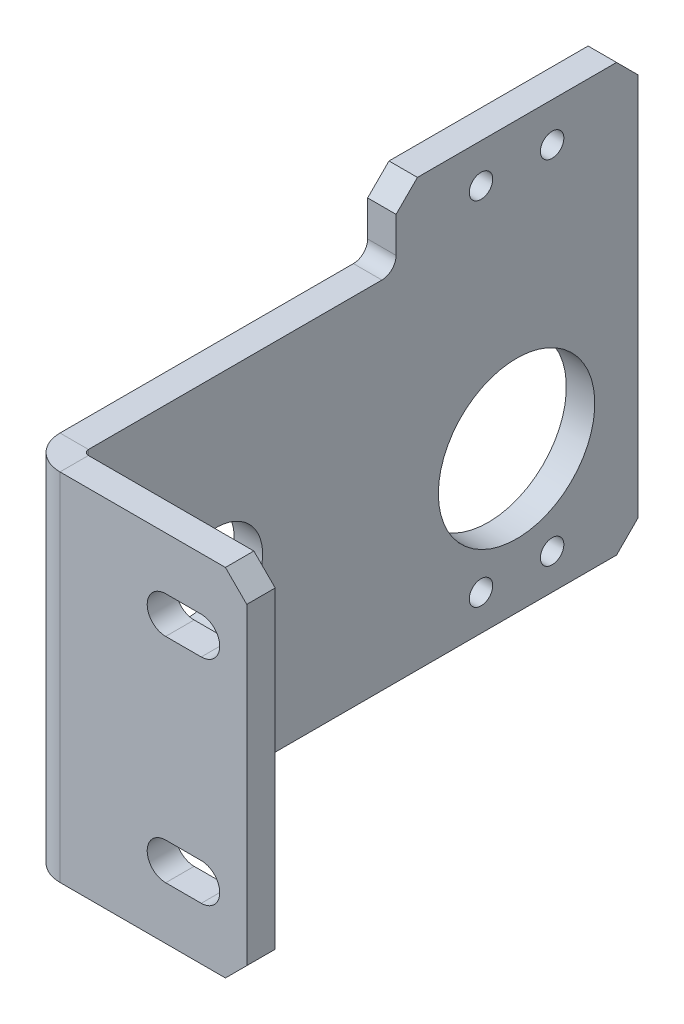
from build123d import *

# Parameters (mm, degrees)
SM_BASE_FLANGE_1_DEPTH = 50
SKETCH_3_R             = 6.5
CUT_EXTRUDE_2_DEPTH    = 101.920760996
SKETCH_5_R             = 11
CUT_EXTRUDE_5_DEPTH    = 101.920760996
SKETCH_6_W             = 4
SKETCH_6_H             = 34
EXTRUDE_2_DEPTH        = 10
CHAMFER_1_SIZE         = 3
CUT_EXTRUDE_6_DEPTH    = 107.230880633
PATTERN_LINEAR_3_COUNT = 2
PATTERN_LINEAR_3_PITCH = 30
FILLET_1_R             = 2
M4X0_7_1_D             = 3.3


# Sheet-metal steps are written as plain solids
with BuildPart() as part:
    # Sketch 1 → 基材-凸緣1 (new body)
    with BuildSketch(Plane(origin=(0, 0, 0), x_dir=(1, 0, 0), z_dir=(0, 1, 0))):
        with BuildLine():
            Line((31, 0), (4.7366, 0))
            ThreePointArc((4.7366, 0), (1.38731802, 1.38731802), (0, 4.7366))
            Line((0, 4.7366), (0, 82))
            Line((0, 82), (4, 82))
            Line((4, 82), (4, 4.7366))
            ThreePointArc((4, 4.7366), (4.215745145, 4.215745145), (4.7366, 4))
            Line((4.7366, 4), (31, 4))
            Line((31, 4), (31, 0))
        make_face()
    extrude(amount=SM_BASE_FLANGE_1_DEPTH)

    # 草圖3 → 除料-伸長2 (cut, through all)
    with BuildSketch(Plane.ZY):
        with Locations((-22.7366, 25)):
            Circle(SKETCH_3_R)
    extrude(amount=-CUT_EXTRUDE_2_DEPTH, mode=Mode.SUBTRACT)

    # 草圖5 → 除料-伸長5 (cut, through all)
    with BuildSketch(Plane.ZY):
        with Locations((-64.94145754, 20)):
            Circle(SKETCH_5_R)
    extrude(amount=-CUT_EXTRUDE_5_DEPTH, mode=Mode.SUBTRACT)

    # 草圖6 → 填料-伸長2 (add)
    with BuildSketch(Plane(origin=(0, 50, 0), x_dir=(1, 0, 0), z_dir=(0, 1, 0))):
        with Locations((2, 65)):
            Rectangle(SKETCH_6_W, SKETCH_6_H)
    extrude(amount=EXTRUDE_2_DEPTH)

    # 導角1
    chamfer_1_edges = [part.edges().sort_by_distance(p)[0] for p in [
        (31, 50, -2),
        (2, 60, -48),
        (2, 60, -82),
        (31, 0, -2),
        (2, 0, -82),
    ]]
    chamfer(chamfer_1_edges, length=CHAMFER_1_SIZE)

    # 草圖8 → 除料-伸長6 (cut, through all)
    with BuildSketch(Plane.XY):
        with BuildLine():
            Line((19.6, 42.6), (24.6, 42.6))
            ThreePointArc((24.6, 42.6), (27.2, 40), (24.6, 37.4))
            Line((24.6, 37.4), (19.6, 37.4))
            ThreePointArc((19.6, 37.4), (17, 40), (19.6, 42.6))
        make_face()
    cut_extrude_6 = extrude(amount=-CUT_EXTRUDE_6_DEPTH, mode=Mode.SUBTRACT)

    # 直線複製排列3: 除料-伸長6 ×2
    with Locations(*[(0, -i * PATTERN_LINEAR_3_PITCH, 0) for i in range(1, PATTERN_LINEAR_3_COUNT)]):
        add(cut_extrude_6, mode=Mode.SUBTRACT)

    # 圓角1
    fillet_1_edges = [part.edges().sort_by_distance(p)[0] for p in [
        (2, 50, -48),
    ]]
    fillet(fillet_1_edges, radius=FILLET_1_R)

    # M4x0.7 螺紋孔1 (through all)
    with Locations(Plane.ZY):
        with Locations((-59.94145754, 5), (-69.94145754, 5), (-69.94145754, 54.5), (-59.94145754, 54.5)):
            Hole(M4X0_7_1_D / 2)


solid = part.part
